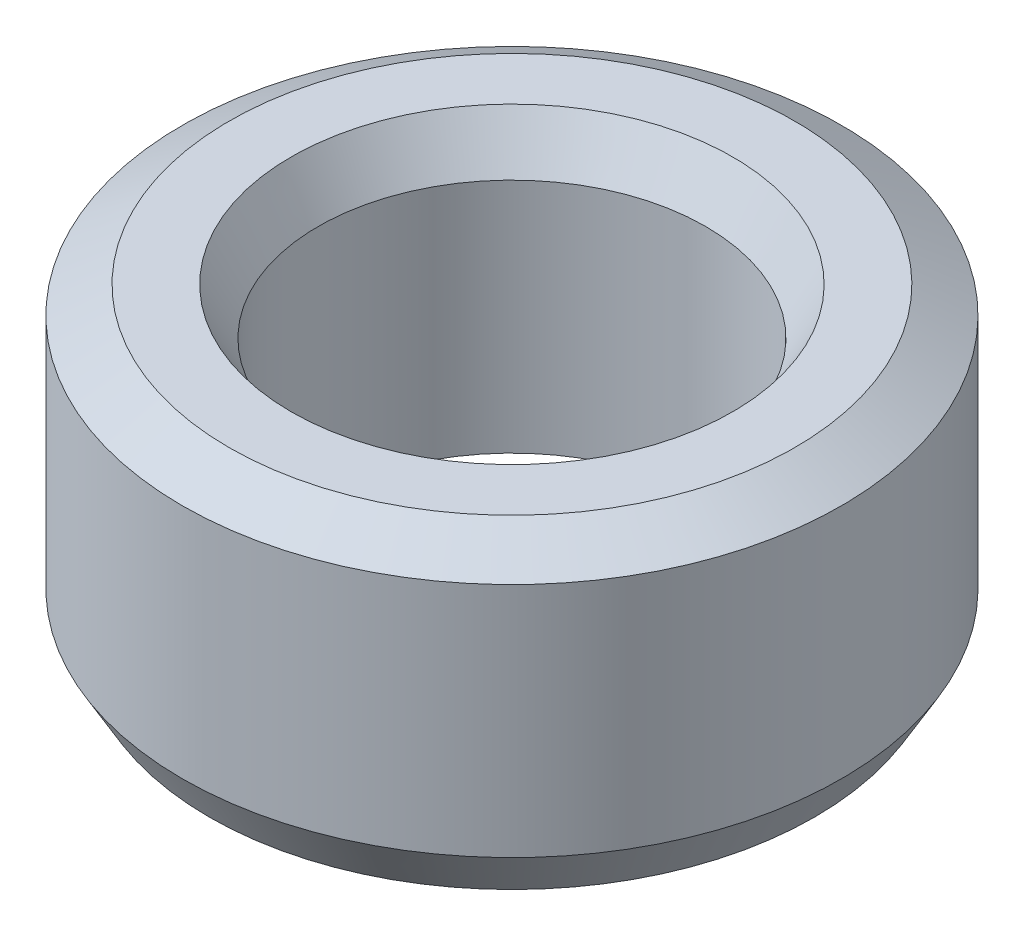
from build123d import *
from OCP.BRepFilletAPI import BRepFilletAPI_MakeChamfer

# Parameters (mm, degrees)
SKETCH1_R           = 37.5
BOSS_EXTRUDE1_DEPTH = 35.293867645
SKETCH2_R           = 22.050314184
CUT_EXTRUDE1_DEPTH  = 64.703666247
CHAMFER1_SIZE       = 3.071300908
CHAMFER1_SIZE2      = 5.319649217


with BuildPart() as part:
    # Sketch1 → Boss-Extrude1 (new body)
    with BuildSketch(Plane(origin=(0, 0, 0), x_dir=(1, 0, 0), z_dir=(0, 1, 0))):
        Circle(SKETCH1_R)
    extrude(amount=BOSS_EXTRUDE1_DEPTH)

    # Sketch2 → Cut-Extrude1 (cut, through all)
    with BuildSketch(Plane(origin=(0, 0, 0), x_dir=(1, 0, 0), z_dir=(0, 1, 0))):
        Circle(SKETCH2_R)
    extrude(amount=CUT_EXTRUDE1_DEPTH, mode=Mode.SUBTRACT)

    # Chamfer1: one chamfer whose edges measure the first distance from different faces: ONE call of the kernel's chamfer builder (chamfer() names one face for all edges)
    chamfer1_edges_1 = [part.edges().sort_by_distance(p)[0] for p in [
        (-22.050314184, 35.293867645, 0),
    ]]
    chamfer1_side_1 = [part.faces().sort_by_distance(p)[0] for p in [
        (-36.439339828, 35.293867645, 0),
    ]]
    chamfer1_edges_2 = [part.edges().sort_by_distance(p)[0] for p in [
        (-22.050314184, 0, 0),
    ]]
    chamfer1_side_2 = [part.faces().sort_by_distance(p)[0] for p in [
        (-22.050314184, 17.646933823, 0),
    ]]
    chamfer1_edges_3 = [part.edges().sort_by_distance(p)[0] for p in [
        (-37.5, 0, 0),
    ]]
    chamfer1_side_3 = [part.faces().sort_by_distance(p)[0] for p in [
        (-36.439339828, 0, 0),
    ]]
    chamfer1_edges_4 = [part.edges().sort_by_distance(p)[0] for p in [
        (-37.5, 35.293867645, 0),
    ]]
    chamfer1_side_4 = [part.faces().sort_by_distance(p)[0] for p in [
        (-37.5, 17.646933823, 0),
    ]]
    chamfer1 = BRepFilletAPI_MakeChamfer(part.part.solid().wrapped)
    for e in chamfer1_edges_1:
        chamfer1.Add(CHAMFER1_SIZE, CHAMFER1_SIZE2, e.wrapped, chamfer1_side_1[0].wrapped)  # the first distance lies on this face
    for e in chamfer1_edges_2:
        chamfer1.Add(CHAMFER1_SIZE, CHAMFER1_SIZE2, e.wrapped, chamfer1_side_2[0].wrapped)  # the first distance lies on this face
    for e in chamfer1_edges_3:
        chamfer1.Add(CHAMFER1_SIZE, CHAMFER1_SIZE2, e.wrapped, chamfer1_side_3[0].wrapped)  # the first distance lies on this face
    for e in chamfer1_edges_4:
        chamfer1.Add(CHAMFER1_SIZE, CHAMFER1_SIZE2, e.wrapped, chamfer1_side_4[0].wrapped)  # the first distance lies on this face
    add(Compound.cast(chamfer1.Shape()), mode=Mode.REPLACE)


solid = part.part
